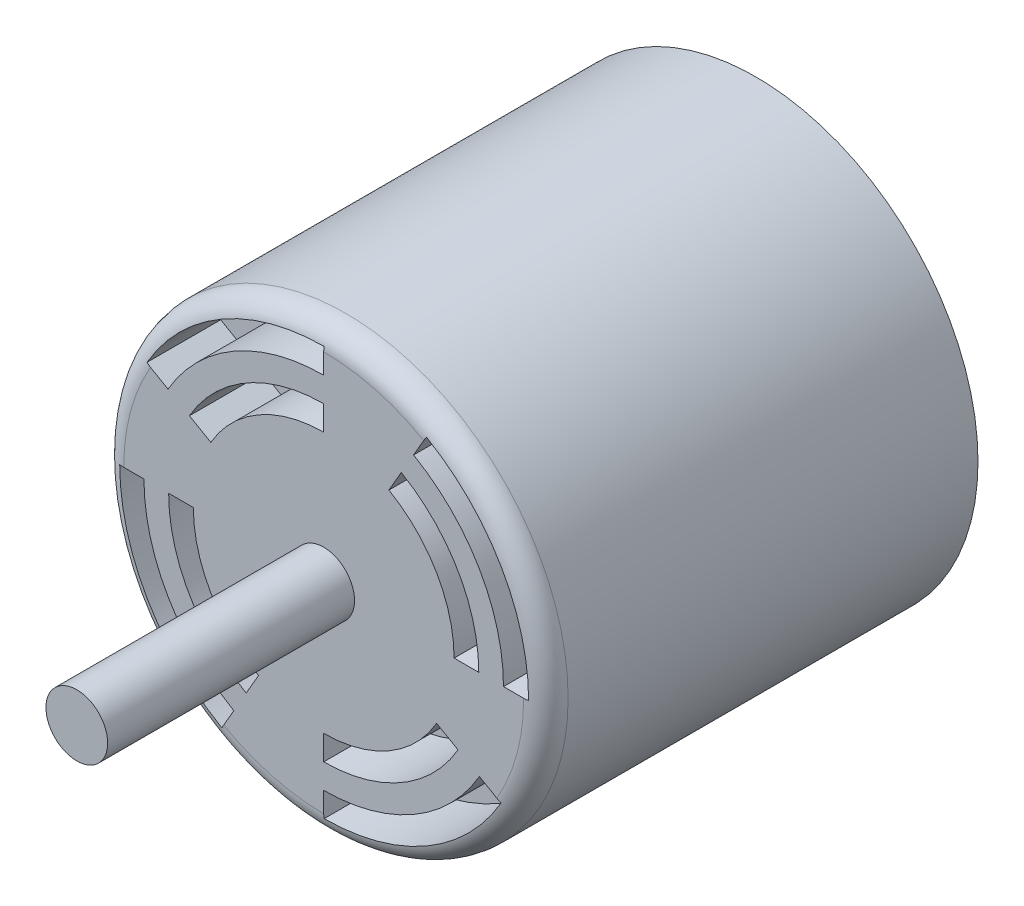
from build123d import *

# Parameters (mm, degrees)
SKETCH1_R           = 22.86
BOSS_EXTRUDE1_DEPTH = 44.45
SKETCH2_R           = 3.175
BOSS_EXTRUDE2_DEPTH = 25.4
CUT_EXTRUDE1_DEPTH  = 7.62
FILLET1_R           = 2.286
SKETCH4_R           = 2.54
BOSS_EXTRUDE3_DEPTH = 6.35


with BuildPart() as part:
    # Sketch1 → Boss-Extrude1 (new body)
    with BuildSketch(Plane.XY):
        Circle(SKETCH1_R)
    extrude(amount=BOSS_EXTRUDE1_DEPTH)

    # Sketch2 → Boss-Extrude2 (add)
    with BuildSketch(Plane.XY.offset(44.45)):
        Circle(SKETCH2_R)
    extrude(amount=BOSS_EXTRUDE2_DEPTH)

    # Sketch3 → Cut-Extrude1 (cut)
    with BuildSketch(Plane.XY.offset(44.45)):
        with BuildLine():
            Line((13.413435382, 0), (15.953435382, 0))
            ThreePointArc((15.953435382, 0), (13.816080318, 7.976717691), (7.976717691, 13.816080318))
            Line((7.976717691, 13.816080318), (6.706717691, 11.616375793))
            ThreePointArc((6.706717691, 11.616375793), (11.616375793, 6.706717691), (13.413435382, 0))
        make_face()
        with BuildLine():
            Line((9.246717691, 16.015784844), (10.516717691, 18.215489369))
            ThreePointArc((10.516717691, 18.215489369), (18.215489369, 10.516717691), (21.033435382, 0))
            Line((21.033435382, 0), (18.493435382, 0))
            ThreePointArc((18.493435382, 0), (16.015784844, 9.246717691), (9.246717691, 16.015784844))
        make_face()
        with BuildLine():
            Line((11.616375793, -6.706717691), (13.816080318, -7.976717691))
            ThreePointArc((13.816080318, -7.976717691), (7.976717691, -13.816080318), (0, -15.953435382))
            Line((0, -15.953435382), (0, -13.413435382))
            ThreePointArc((0, -13.413435382), (6.706717691, -11.616375793), (11.616375793, -6.706717691))
        make_face()
        with BuildLine():
            Line((16.015784844, -9.246717691), (18.215489369, -10.516717691))
            ThreePointArc((18.215489369, -10.516717691), (10.516717691, -18.215489369), (0, -21.033435382))
            Line((0, -21.033435382), (0, -18.493435382))
            ThreePointArc((0, -18.493435382), (9.246717691, -16.015784844), (16.015784844, -9.246717691))
        make_face()
        with BuildLine():
            Line((-6.706717691, -11.616375793), (-7.976717691, -13.816080318))
            ThreePointArc((-7.976717691, -13.816080318), (-13.816080318, -7.976717691), (-15.953435382, 0))
            Line((-15.953435382, 0), (-13.413435382, 0))
            ThreePointArc((-13.413435382, 0), (-11.616375793, -6.706717691), (-6.706717691, -11.616375793))
        make_face()
        with BuildLine():
            Line((-9.246717691, -16.015784844), (-10.516717691, -18.215489369))
            ThreePointArc((-10.516717691, -18.215489369), (-18.215489369, -10.516717691), (-21.033435382, 0))
            Line((-21.033435382, 0), (-18.493435382, 0))
            ThreePointArc((-18.493435382, 0), (-16.015784844, -9.246717691), (-9.246717691, -16.015784844))
        make_face()
        with BuildLine():
            Line((-11.616375793, 6.706717691), (-13.816080318, 7.976717691))
            ThreePointArc((-13.816080318, 7.976717691), (-7.976717691, 13.816080318), (0, 15.953435382))
            Line((0, 15.953435382), (0, 13.413435382))
            ThreePointArc((0, 13.413435382), (-6.706717691, 11.616375793), (-11.616375793, 6.706717691))
        make_face()
        with BuildLine():
            Line((-16.015784844, 9.246717691), (-18.215489369, 10.516717691))
            ThreePointArc((-18.215489369, 10.516717691), (-10.516717691, 18.215489369), (0, 21.033435382))
            Line((0, 21.033435382), (0, 18.493435382))
            ThreePointArc((0, 18.493435382), (-9.246717691, 16.015784844), (-16.015784844, 9.246717691))
        make_face()
    extrude(amount=-CUT_EXTRUDE1_DEPTH, mode=Mode.SUBTRACT)

    # Fillet1
    # the kernel refuses this fillet: 2.286 mm, written as the material it takes off along each edge
    with BuildSketch(Plane(origin=(0, 0, 44.45), x_dir=(1, 0, 0), z_dir=(0, -1, 0))) as fillet1_piece_1:
        with BuildLine():
            CenterArc((22.86 - FILLET1_R, -FILLET1_R), FILLET1_R, 0, 90)
            Line((22.86 - FILLET1_R, 0), (22.86, 0))
            Line((22.86, 0), (22.86, -FILLET1_R))
        make_face()
    revolve(axis=Axis((0, 0, 44.45), (0, 0, 1)), mode=Mode.SUBTRACT)

    # Sketch4 → Boss-Extrude3 (add)
    with BuildSketch(Plane(origin=(0, 0, 0), x_dir=(-1, 0, 0), z_dir=(0, 0, -1))):
        with Locations(Location((0, 0, 0), (0, 0, 180))):
            Circle(SKETCH4_R)
    extrude(amount=BOSS_EXTRUDE3_DEPTH)


solid = part.part
